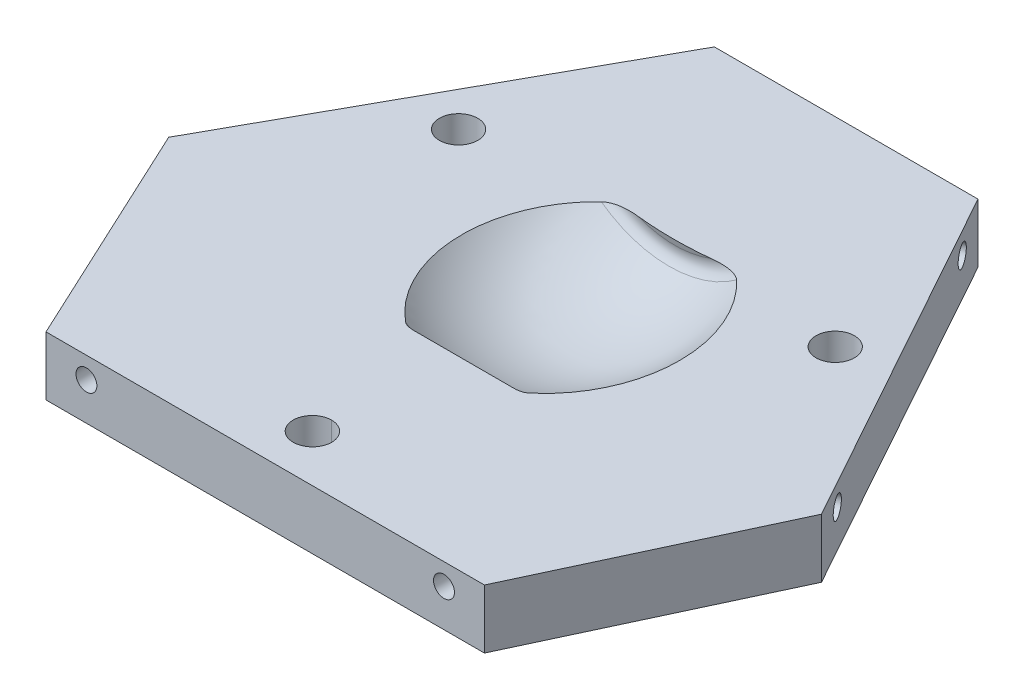
from build123d import *

# Parameters (mm, degrees)
BOSS_EXTRUDE1_DEPTH      = 5.291666667
BOSS_EXTRUDE1_DEPTH_BACK = 2
SCALE1_SCALE             = 1.2
SKETCH2_R                = 1.55
CUT_EXTRUDE1_DEPTH       = 5
SKETCH3_R                = 1.55
CUT_EXTRUDE2_DEPTH       = 5
SKETCH4_R                = 1.55
CUT_EXTRUDE3_DEPTH       = 5
SKETCH6_R                = 2.85
CUT_EXTRUDE5_DEPTH       = 10


# Read off the part's stored shape, not the designer's step: Cavity1
with BuildPart() as part:
    # Sketch1 → Boss-Extrude1 (new, two sides: drawn at the far end of the back side and taken through both)
    with BuildSketch(Plane(origin=(0, 0, 0), x_dir=(1, 0, 0), z_dir=(0, 1, 0)).offset(-BOSS_EXTRUDE1_DEPTH_BACK)):
        Polygon((0, 0), (54.205585529, 0), (67.458894217, 28.421812201), (43.397792765, 71.829188267), (10.807792765, 71.829188267), (-13.253308688, 28.421812201), align=None)
    extrude(amount=BOSS_EXTRUDE1_DEPTH + BOSS_EXTRUDE1_DEPTH_BACK)


with BuildPart() as part_1:
    # Scale1: scaled about (27.102792765, 1.645833333, -33.072398266)
    add(part.part.scale(SCALE1_SCALE).moved(Location((-5.420558553, -0.329166667, 6.614479653))))

    # Sketch2 → Cut-Extrude1 (cut)
    with BuildSketch(Plane.XY.offset(6.614479653)):
        with Locations((0.579441447, 2.845833333)):
            Circle(SKETCH2_R)
        with Locations((53.626144082, 2.845833333)):
            Circle(SKETCH2_R)
    extrude(amount=-CUT_EXTRUDE1_DEPTH, mode=Mode.SUBTRACT)

    # Sketch3 → Cut-Extrude2 (cut)
    with BuildSketch(Plane(origin=(69.434628405, 0, -38.488243009), x_dir=(-0.4848096202463384, 0, -0.874619707139395), z_dir=(0.8746197071393951, 0, -0.48480962024633845))):
        with Locations((-6.572947912, 2.845833333)):
            Circle(SKETCH3_R)
        with Locations((40.983052088, 2.845833333)):
            Circle(SKETCH3_R)
    extrude(amount=-CUT_EXTRUDE2_DEPTH, mode=Mode.SUBTRACT)

    # Sketch4 → Cut-Extrude3 (cut)
    with BuildSketch(Plane(origin=(-27.96954364, 0, -15.503771205), x_dir=(-0.484809620246335, 0, 0.8746197071393971), z_dir=(-0.8746197071393971, 0, -0.484809620246335))):
        with Locations((-67.262441424, 2.845833333)):
            Circle(SKETCH4_R)
        with Locations((-19.706441424, 2.845833333)):
            Circle(SKETCH4_R)
    extrude(amount=-CUT_EXTRUDE3_DEPTH, mode=Mode.SUBTRACT)

    # Cavity1 outline → Cavity1 (revolve, cut)
    with BuildSketch(Plane(origin=(29.100070557, 19.820833333, 0), x_dir=(1, 0, 0), z_dir=(0, -1, 0))):
        with BuildLine():
            Line((13.8, -20.845521087), (13.8, -51.862134575))
            ThreePointArc((13.8, -51.862134575), (14.301807507, -52.001142443), (14.802096148, -52.145521243))
            ThreePointArc((14.802096148, -52.145521243), (16.075454027, -52.097235211), (17.061194774, -51.289715753))
            ThreePointArc((17.061194774, -51.289715753), (21.249999954, -36.203406393), (16.503897888, -21.283039973))
            ThreePointArc((16.503897888, -21.283039973), (16.144807315, -20.961644166), (15.677087754, -20.845521087))
            Line((15.677087754, -20.845521087), (13.8, -20.845521087))
        make_face()
    revolve(axis=Axis((29.100070557, 19.820833333, 0), (0, 0, 1)), mode=Mode.SUBTRACT)

    # Sketch6 → Cut-Extrude5 (cut)
    with BuildSketch(Plane(origin=(0, 6.020833333, 0), x_dir=(1, 0, 0), z_dir=(0, 1, 0))):
        with Locations(Location((27.094441447, 0.385520347, 0), (0, 0, 270))):
            Circle(SKETCH6_R)
        with Locations(Location((55.04286751, 50.013009569, 0), (0, 0, 270))):
            Circle(SKETCH6_R)
    cut_extrude5 = extrude(amount=-CUT_EXTRUDE5_DEPTH, mode=Mode.SUBTRACT)

    # Mirror1: Cut-Extrude5 across plane
    add(cut_extrude5.mirror(Plane(origin=(27.102792765, 0, 0), x_dir=(0, 0, 1), z_dir=(1, 0, 0))), mode=Mode.SUBTRACT)


solid = part_1.part
